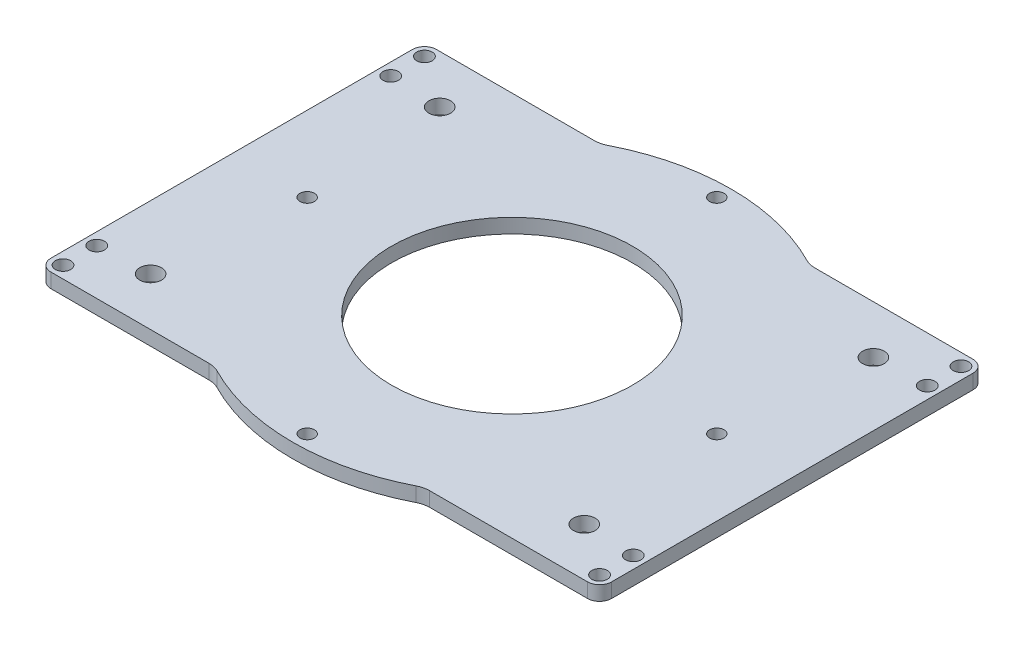
from build123d import *

# Parameters (mm, degrees)
SKETCH1_R           = 2.25
SKETCH1_R_2         = 25
SKETCH1_R_3         = 1.5
SKETCH1_R_4         = 1.6
BOSS_EXTRUDE1_DEPTH = 3


with BuildPart() as part:
    # Sketch1 → Boss-Extrude1 (new body)
    with BuildSketch(Plane(origin=(0, 0, 0), x_dir=(1, 0, 0), z_dir=(0, 1, 0))):
        with BuildLine():
            Line((58.175, -37.5), (58.175, 37.5))
            ThreePointArc((58.175, 37.5), (57.442766953, 39.267766953), (55.675, 40))
            Line((55.675, 40), (22.918333273, 40))
            ThreePointArc((22.918333273, 40), (21.751548743, 40.138044235), (20.649191365, 40.544554455))
            ThreePointArc((20.649191365, 40.544554455), (0, 45.5), (-20.649191365, 40.544554455))
            ThreePointArc((-20.649191365, 40.544554455), (-21.751548743, 40.138044235), (-22.918333273, 40))
            Line((-22.918333273, 40), (-55.675, 40))
            ThreePointArc((-55.675, 40), (-57.442766953, 39.267766953), (-58.175, 37.5))
            Line((-58.175, 37.5), (-58.175, -37.5))
            ThreePointArc((-58.175, -37.5), (-57.442766953, -39.267766953), (-55.675, -40))
            Line((-55.675, -40), (-22.918333273, -40))
            ThreePointArc((-22.918333273, -40), (-21.751548743, -40.138044235), (-20.649191365, -40.544554455))
            ThreePointArc((-20.649191365, -40.544554455), (0, -45.5), (20.649191365, -40.544554455))
            ThreePointArc((20.649191365, -40.544554455), (21.751548743, -40.138044235), (22.918333273, -40))
            Line((22.918333273, -40), (55.675, -40))
            ThreePointArc((55.675, -40), (57.442766953, -39.267766953), (58.175, -37.5))
        make_face()
        with Locations((-45, 30)):
            Circle(SKETCH1_R, mode=Mode.SUBTRACT)
        with Locations((-45, -30)):
            Circle(SKETCH1_R, mode=Mode.SUBTRACT)
        with Locations((45, -30)):
            Circle(SKETCH1_R, mode=Mode.SUBTRACT)
        with Locations((45, 30)):
            Circle(SKETCH1_R, mode=Mode.SUBTRACT)
        Circle(SKETCH1_R_2, mode=Mode.SUBTRACT)
        with Locations((0, 42.5)):
            Circle(SKETCH1_R_3, mode=Mode.SUBTRACT)
        with Locations((42.5, 0)):
            Circle(SKETCH1_R_3, mode=Mode.SUBTRACT)
        with Locations((0, -42.5)):
            Circle(SKETCH1_R_3, mode=Mode.SUBTRACT)
        with Locations((-42.5, 0)):
            Circle(SKETCH1_R_3, mode=Mode.SUBTRACT)
        with Locations((55.675, 37.5)):
            Circle(SKETCH1_R_4, mode=Mode.SUBTRACT)
        with Locations((55.675, 30.5)):
            Circle(SKETCH1_R_4, mode=Mode.SUBTRACT)
        with Locations((-55.675, 30.5)):
            Circle(SKETCH1_R_4, mode=Mode.SUBTRACT)
        with Locations((-55.675, 37.5)):
            Circle(SKETCH1_R_4, mode=Mode.SUBTRACT)
        with Locations((-55.675, -37.5)):
            Circle(SKETCH1_R_4, mode=Mode.SUBTRACT)
        with Locations((-55.675, -30.5)):
            Circle(SKETCH1_R_4, mode=Mode.SUBTRACT)
        with Locations((55.675, -37.5)):
            Circle(SKETCH1_R_4, mode=Mode.SUBTRACT)
        with Locations((55.675, -30.5)):
            Circle(SKETCH1_R_4, mode=Mode.SUBTRACT)
    extrude(amount=BOSS_EXTRUDE1_DEPTH)


solid = part.part
